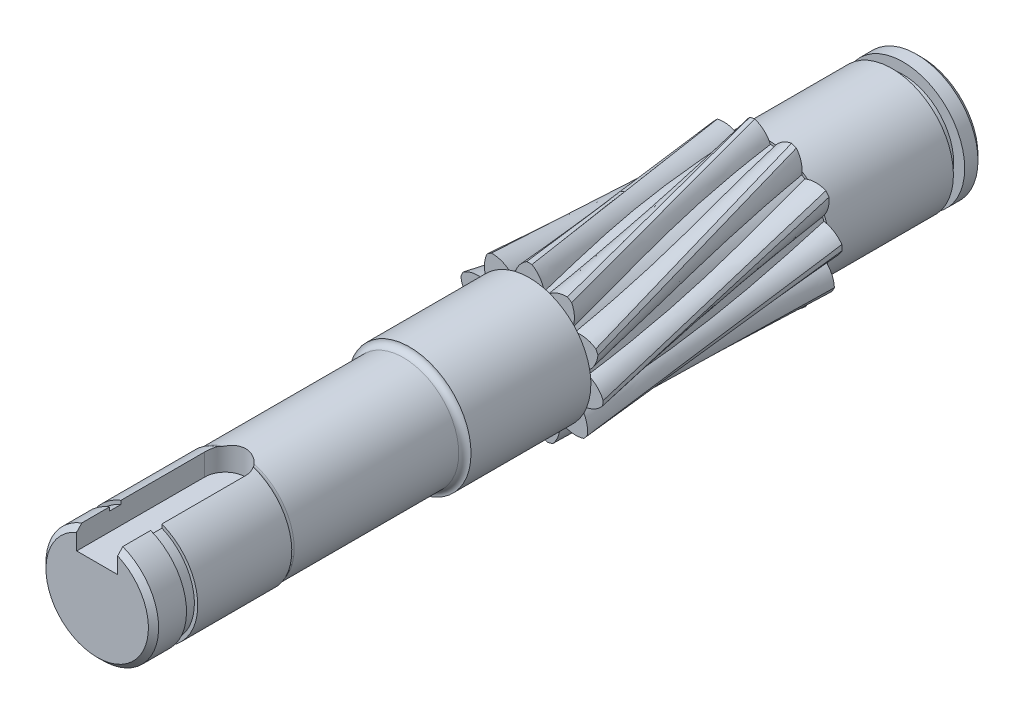
from build123d import *

# Parameters (mm, degrees)
ESQUISSE5_R                  = 5.75
EXTRUSION1_DEPTH             = 23.3
R_P_TITION_CIRCULAIRE2_COUNT = 11
ENL_V_MAT_EXTRU_1_DEPTH      = 2.5


with BuildPart() as part:
    # Esquisse5 → Extrusion1 (new body)
    with BuildSketch(Plane.XY):
        Circle(ESQUISSE5_R)
    extrude(amount=-EXTRUSION1_DEPTH)

    # Esquisse1 for Lissage3 → Lissage3 section 0
    with BuildSketch(Plane.XY):
        with BuildLine():
            # circular arc as an exact rational Bezier (weights 1, cos(half-angle), 1)
            Bezier((-0.25, 7.245688373), (0, 7.254314193), (0.25, 7.245688373), weights=[1, 0.999405293, 1])
            Bezier((0.25, 7.245688373), (1.21122146, 6.66271225), (1.45, 5.564171097), weights=[1, 0.918790004, 1])
            Bezier((1.45, 5.564171097), (0, 5.942035107), (-1.45, 5.564171097), weights=[1, 0.96768193, 1])
            Bezier((-1.45, 5.564171097), (-1.21122146, 6.66271225), (-0.25, 7.245688373), weights=[1, 0.918790004, 1])
        make_face()
    # Esquisse6 for Lissage3 → Lissage3 section 1
    with BuildSketch(Plane(origin=(0, 0, -23.3), x_dir=(-1, 0, 0), z_dir=(0, 0, -1))):
        with BuildLine():
            Bezier((5.300252078, 4.946698688), (5.129574758, 5.129574758), (4.946698688, 5.300252078), weights=[1, 0.999405293, 1])
            Bezier((4.946698688, 5.300252078), (3.854786105, 5.567711921), (2.909158282, 4.959767947), weights=[1, 0.918790004, 1])
            Bezier((2.909158282, 4.959767947), (4.201653318, 4.201653318), (4.959767947, 2.909158282), weights=[1, 0.96768193, 1])
            Bezier((4.959767947, 2.909158282), (5.567711921, 3.854786105), (5.300252078, 4.946698688), weights=[1, 0.918790004, 1])
        make_face()
    lissage3 = loft()

    # Répétition circulaire2: Lissage3 ×11 about axis
    r_p_tition_circulaire2_axis = Axis((0, 0, -23.3), (0, 0, 1))
    for i in range(1, R_P_TITION_CIRCULAIRE2_COUNT):
        add(lissage3.rotate(r_p_tition_circulaire2_axis, i * 360 / R_P_TITION_CIRCULAIRE2_COUNT))

    # Esquisse7 → Révolution1 (revolve)
    with BuildSketch(Plane(origin=(0, 0, 0), x_dir=(0, 0, -1), z_dir=(1, 0, 0))):
        with BuildLine():
            Line((-42.2, 0), (-42.2, 5))
            Line((-42.2, 5), (-41.7, 5.5))
            Line((-41.7, 5.5), (-38.98, 5.5))
            Line((-38.98, 5.5), (-38.98, 5.17))
            Line((-38.98, 5.17), (-37.88, 5.17))
            Line((-37.88, 5.17), (-37.88, 5.5))
            Line((-37.88, 5.5), (-28.7, 5.5))
            ThreePointArc((-28.7, 5.5), (-28.541542602, 5.425543735), (-28.368337521, 5.4))
            Line((-28.368337521, 5.4), (-12.3, 5.4))
            ThreePointArc((-12.3, 5.4), (-11.875735931, 5.575735931), (-11.7, 6))
            Line((-11.7, 6), (0, 6))
            Line((0, 6), (0, 0))
            Line((0, 0), (-42.2, 0))
        make_face()
        Polygon((38.3, 5.5), (38.3, 0), (23.3, 0), (23.3, 6), (35.4, 6), (35.4, 4.92), (36.5, 4.92), (36.5, 6), (37.8, 6), align=None)
    revolve(axis=Axis((0, 0, 54.405389825), (0, 0, -1)))

    # Esquisse8 → Enlèv. mat.-Extru.1 (cut)
    with BuildSketch(Plane(origin=(0, 5.5, 33.29), x_dir=(-1, 0, 0), z_dir=(0, 1, 0))):
        with BuildLine():
            Line((-2, 8.91), (-2, -3.59))
            ThreePointArc((-2, -3.59), (0, -5.59), (2, -3.59))
            Line((2, -3.59), (2, 8.91))
            Line((2, 8.91), (-2, 8.91))
        make_face()
    extrude(amount=-ENL_V_MAT_EXTRU_1_DEPTH, mode=Mode.SUBTRACT)


solid = part.part
